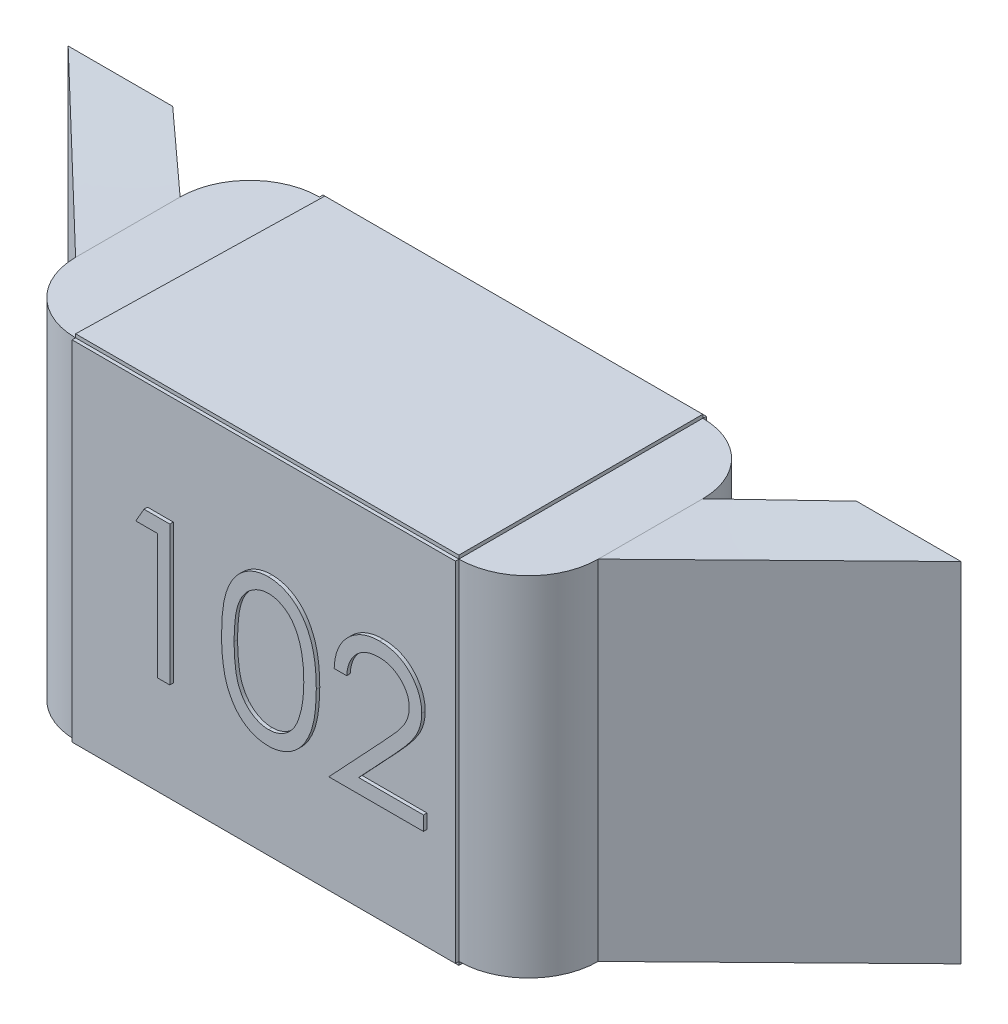
from build123d import *

# Parameters (mm, degrees)
BOSS_EXTRU_1_DEPTH      = 0.35
BOSS_EXTRU_1_DEPTH_BACK = 0.35
ESQUISSE1_W             = 1.5
ESQUISSE1_H             = 1
ESQUISSE2_W             = 1.1
ESQUISSE2_H             = 1
BOSS_EXTRU_2_DEPTH      = 0.01
BOSS_EXTRU_3_DEPTH      = 0.01
CONG_1_R                = 0.2
BOSS_EXTRU_4_DEPTH      = 0.01


with BuildPart() as part:
    # Esquisse1 → Boss.-Extru.1 (new, two sides: drawn at the far end of the back side and taken through both)
    with BuildSketch(Plane.XY.offset(-BOSS_EXTRU_1_DEPTH_BACK)):
        Rectangle(ESQUISSE1_W, ESQUISSE1_H)
    extrude(amount=BOSS_EXTRU_1_DEPTH + BOSS_EXTRU_1_DEPTH_BACK)

    # Esquisse2 → Boss.-Extru.2 (add)
    with BuildSketch(Plane.XY.offset(0.35)):
        Rectangle(ESQUISSE2_W, ESQUISSE2_H)
    boss_extru_2 = extrude(amount=BOSS_EXTRU_2_DEPTH)

    # Esquisse3 → Boss.-Extru.3 (add)
    with BuildSketch(Plane.XZ.offset(0.5)):
        Polygon((-0.55, 0.35), (-0.534610183, -0.35), (0.55, -0.35), (0.55, 0.35), align=None)
    boss_extru_3 = extrude(amount=BOSS_EXTRU_3_DEPTH)

    # Symétrie1: Boss.-Extru.2 across plane
    add(boss_extru_2.mirror(Plane.XY))

    # Symétrie2: Boss.-Extru.3 across plane
    add(boss_extru_3.mirror(Plane.ZX))

    # Congé1
    cong_1_edges = [part.edges().sort_by_distance(p)[0] for p in [
        (-0.75, 0, 0.35),
        (-0.75, 0, -0.35),
        (0.75, 0, -0.35),
        (0.75, 0, 0.35),
    ]]
    fillet(cong_1_edges, radius=CONG_1_R - 0.0001)  # a hair under: the kernel refuses the full size

    # Lissage3: read off the stored shape, not the designer's step
    # Lissage3: loft between two sections, ruled curve by curve
    lissage3_from = [
        Edge.make_bspline([(-0.75, -0.5, -0.15), (-0.75, -0.5, -0.1), (-0.75, -0.5, -0.05), (-0.75, -0.5, 0.05), (-0.75, -0.5, 0.1), (-0.75, -0.5, 0.15)], [0, 0, 0, 0, 0.5, 0.5, 1, 1, 1, 1], 3),
        Edge.make_bspline([(-0.75, 0.5, 0.15), (-0.75, 0.5, 0.1), (-0.75, 0.5, 0.05), (-0.75, 0.5, -0.05), (-0.75, 0.5, -0.1), (-0.75, 0.5, -0.15)], [0, 0, 0, 0, 0.5, 0.5, 1, 1, 1, 1], 3),
        Edge.make_line((-0.75, 0.5, 0.15), (-0.75, -0.5, 0.15)),
        Edge.make_line((-0.75, -0.5, -0.15), (-0.75, 0.5, -0.15)),
    ]
    lissage3_to = [
        Edge.make_bspline([(-0.981354224, -0.495363438, -0.36), (-1.031354224, -0.495363438, -0.36), (-1.081354224, -0.495363438, -0.36), (-1.181354224, -0.495363438, -0.36), (-1.231354224, -0.495363438, -0.36), (-1.281354224, -0.495363438, -0.36)], [0, 0, 0, 0, 0.5, 0.5, 1, 1, 1, 1], 3),
        Edge.make_bspline([(-1.281354224, 0.504636562, -0.36), (-1.231354224, 0.504636562, -0.36), (-1.181354224, 0.504636562, -0.36), (-1.081354224, 0.504636562, -0.36), (-1.031354224, 0.504636562, -0.36), (-0.981354224, 0.504636562, -0.36)], [0, 0, 0, 0, 0.5, 0.5, 1, 1, 1, 1], 3),
        Edge.make_line((-1.281354224, 0.504636562, -0.36), (-1.281354224, -0.495363438, -0.36)),
        Edge.make_line((-0.981354224, -0.495363438, -0.36), (-0.981354224, 0.504636562, -0.36)),
    ]
    lissage3 = Solid(Shell([*[Face.make_surface_from_curves(lissage3_from[k], lissage3_to[k]) for k in range(4)], Face(Wire(lissage3_from)), Face(Wire(lissage3_to))]))
    add(lissage3)

    # Symétrie6: Lissage3 across plane
    add(lissage3.mirror(Plane(origin=(0, 0, 0), x_dir=(0, 0, 1), z_dir=(1, 0, 0))))

    # Esquisse7 → Boss.-Extru.4 (add)
    # profile 1 of 3: a face of its own
    with BuildSketch(Plane.XY.offset(0.36)):
        Polygon((-0.333671765, 0.19228437), (-0.259713432, 0.19228437), (-0.259713432, -0.20771563), (-0.295610868, -0.20771563), (-0.295610868, 0.151258729), (-0.357149329, 0.151258729), align=None)
    # profile 2 of 3: a face of its own
    with BuildSketch(Plane.XY.offset(0.36)):
        with BuildLine():
            add(Edge.make_bspline(
                [(-0.110995483, -0.007875886), (-0.110957996, -0.001464756), (-0.110885175, 0.010988956), (-0.11007507, 0.029135772), (-0.108729316, 0.046159805), (-0.106885045, 0.06206187), (-0.104640705, 0.076846072), (-0.101644649, 0.090472901), (-0.098237471, 0.103005428), (-0.094288621, 0.114484519), (-0.089832873, 0.125064828), (-0.084983243, 0.134941994), (-0.079547267, 0.144101072), (-0.07383562, 0.152688248), (-0.067617097, 0.160562956), (-0.061068664, 0.167836403), (-0.053934735, 0.174340488), (-0.04645782, 0.18026578), (-0.038570224, 0.185460005), (-0.030496777, 0.190035176), (-0.022181907, 0.193943732), (-0.013602915, 0.197016925), (-0.004836908, 0.199555307), (0.004146756, 0.201291187), (0.013362912, 0.202383405), (0.019583648, 0.202487824), (0.022738491, 0.20254078)],
                knots=[0, 0, 0, 0, 1.646270934, 3.197905019, 4.663502075, 6.030701355, 7.308322542, 8.50163776, 9.611534131, 10.641858119, 11.616356847, 12.558055219, 13.465016945, 14.349605745, 15.204443733, 16.039544428, 16.859896111, 17.680448484, 18.487036065, 19.28249412, 20.06191084, 20.843045899, 21.620316918, 22.403196591, 23.190181807, 24, 24, 24, 24], degree=3))
            add(Edge.make_bspline(
                [(0.022738491, 0.20254078), (0.025919689, 0.20248503), (0.03224609, 0.20237416), (0.041599275, 0.201308567), (0.050736382, 0.199540438), (0.059618455, 0.197035184), (0.068318453, 0.193927107), (0.076768328, 0.190031436), (0.085020566, 0.185496708), (0.092944028, 0.180168265), (0.100625698, 0.174227434), (0.107876894, 0.1675117), (0.114698275, 0.160088875), (0.121175453, 0.152038376), (0.127124664, 0.143205795), (0.132790199, 0.133744754), (0.137861289, 0.123489798), (0.142745252, 0.11261203), (0.146960907, 0.100810469), (0.150762764, 0.08815164), (0.153834646, 0.074486018), (0.15639342, 0.059885305), (0.158375694, 0.044295878), (0.159819424, 0.027751156), (0.160582063, 0.010240254), (0.160725686, -0.001732071), (0.160799388, -0.007875886)],
                knots=[0, 0, 0, 0, 0.810914788, 1.612654377, 2.396697861, 3.181598691, 3.963628158, 4.749916497, 5.551656086, 6.361998678, 7.18212741, 8.025565596, 8.878627764, 9.750805457, 10.657531673, 11.591944965, 12.560506719, 13.57287815, 14.630710178, 15.753379473, 16.941251878, 18.199788006, 19.531962791, 20.947069417, 22.433333509, 24, 24, 24, 24], degree=3))
            add(Edge.make_bspline(
                [(0.160799388, -0.007875886), (0.160724922, -0.013992905), (0.160579826, -0.025911665), (0.159827974, -0.043343776), (0.158346987, -0.059800695), (0.156494417, -0.075321891), (0.153928593, -0.089842762), (0.150773717, -0.103413556), (0.147270823, -0.116092878), (0.142946846, -0.127776857), (0.138214194, -0.138628482), (0.133065029, -0.148761871), (0.127548477, -0.15826659), (0.121538335, -0.167066561), (0.11513223, -0.175224122), (0.108193054, -0.182595279), (0.100916416, -0.189357641), (0.09321214, -0.19537497), (0.085165106, -0.200641805), (0.076941211, -0.205351959), (0.068394539, -0.209149982), (0.059718773, -0.212411129), (0.050789817, -0.214902609), (0.041618801, -0.216625336), (0.032252374, -0.217833547), (0.025920766, -0.217925716), (0.022738491, -0.21797204)],
                knots=[0, 0, 0, 0, 1.561518951, 3.042555995, 4.452378317, 5.7783523, 7.031515105, 8.214008947, 9.334062868, 10.386615937, 11.391082383, 12.354592575, 13.286541444, 14.194233754, 15.072674879, 15.931287219, 16.775624067, 17.606195743, 18.42308326, 19.229000347, 20.022332153, 20.807536673, 21.593273796, 22.3848459, 23.188221202, 24, 24, 24, 24], degree=3))
            add(Edge.make_bspline(
                [(0.022738491, -0.21797204), (0.019583735, -0.217918743), (0.013363172, -0.21781365), (0.004145752, -0.216726366), (-0.004800813, -0.214978309), (-0.01352067, -0.212530697), (-0.022058558, -0.209534715), (-0.030298133, -0.205631437), (-0.038331012, -0.201136115), (-0.046135761, -0.196016638), (-0.053565722, -0.190151303), (-0.060662705, -0.183663956), (-0.067248422, -0.176392709), (-0.073378033, -0.168452375), (-0.079203643, -0.159916004), (-0.084562428, -0.150667047), (-0.089519098, -0.140742178), (-0.094049782, -0.130077274), (-0.098066772, -0.11851671), (-0.101615082, -0.105928233), (-0.1044167, -0.092200732), (-0.106814752, -0.077444461), (-0.108748967, -0.061596012), (-0.110069461, -0.04464678), (-0.110885612, -0.026607328), (-0.110958191, -0.014233639), (-0.110995483, -0.007875886)],
                knots=[0, 0, 0, 0, 0.810891512, 1.598919785, 2.382837074, 3.152667961, 3.926044502, 4.706494248, 5.493654104, 6.291793342, 7.103789334, 7.925228297, 8.761435821, 9.622817696, 10.50288917, 11.416980706, 12.369136599, 13.353924996, 14.394355917, 15.514179734, 16.714354668, 17.994756427, 19.357759367, 20.818452758, 22.365282078, 24, 24, 24, 24], degree=3))
        make_face()
        with BuildLine():
            add(Edge.make_bspline(
                [(-0.075098047, -0.00771563), (-0.075084396, -0.013058338), (-0.075057902, -0.023427486), (-0.074365765, -0.038495288), (-0.073422881, -0.05254904), (-0.072206733, -0.065606587), (-0.070400682, -0.077623731), (-0.068377049, -0.088683123), (-0.06591441, -0.098726236), (-0.063000694, -0.107821986), (-0.05968194, -0.116124737), (-0.056058413, -0.12385059), (-0.052165759, -0.131090811), (-0.047809284, -0.137780366), (-0.043064706, -0.143941071), (-0.03803919, -0.149681966), (-0.032545181, -0.154801621), (-0.024944753, -0.160941833), (-0.01491087, -0.167286877), (-0.002268532, -0.172812144), (0.010722148, -0.176284425), (0.019539433, -0.176725997), (0.023940414, -0.176946399)],
                knots=[0, 0, 0, 0, 1.459021318, 2.831673884, 4.118529203, 5.306027144, 6.411944654, 7.436330062, 8.375795394, 9.233974572, 10.042671642, 10.816086306, 11.563610507, 12.285937304, 12.993564865, 13.685989202, 14.367179055, 15.041617293, 16.353048772, 17.594441528, 18.799311195, 20, 20, 20, 20], degree=3))
            add(Edge.make_bspline(
                [(0.023940414, -0.176946399), (0.028369862, -0.176763796), (0.037219614, -0.176398966), (0.05014919, -0.17287911), (0.062701221, -0.167568306), (0.072538014, -0.161288591), (0.080021733, -0.15530821), (0.085383675, -0.150209393), (0.090305052, -0.144500151), (0.094972718, -0.138340232), (0.099253755, -0.131611948), (0.103146685, -0.124347653), (0.106699068, -0.116527176), (0.108722959, -0.111067777), (0.109757722, -0.108276527)],
                knots=[0, 0, 0, 0, 1.353760809, 2.704726607, 4.075137775, 5.516104923, 6.260822281, 7.007110065, 7.778089737, 8.566572457, 9.372053459, 10.217411131, 11.088608312, 12, 12, 12, 12], degree=3))
            add(Edge.make_bspline(
                [(0.109757722, -0.108276527), (0.110963638, -0.104707414), (0.113412165, -0.097460584), (0.116567797, -0.086219024), (0.119052985, -0.074424422), (0.121288798, -0.062147266), (0.122814862, -0.049297015), (0.124043184, -0.035913428), (0.124766691, -0.021986415), (0.124856376, -0.01252413), (0.124901953, -0.00771563)],
                knots=[0, 0, 0, 0, 0.884706709, 1.796334032, 2.740027952, 3.714592787, 4.726048262, 5.777819803, 6.87074269, 8, 8, 8, 8], degree=3))
            add(Edge.make_bspline(
                [(0.124901953, -0.00771563), (0.124839074, -0.002907907), (0.124716069, 0.006497026), (0.124245899, 0.020270532), (0.123031777, 0.033352562), (0.121683306, 0.045799473), (0.119695052, 0.057542365), (0.117551303, 0.068679542), (0.114671164, 0.079073031), (0.111594618, 0.088885555), (0.10807343, 0.098005629), (0.104197346, 0.106475776), (0.100057717, 0.114336888), (0.095561461, 0.121567395), (0.090761954, 0.128199686), (0.08553252, 0.134100783), (0.080080592, 0.139453579), (0.072444342, 0.145563587), (0.06244728, 0.151793495), (0.050007778, 0.157526725), (0.037062561, 0.160819101), (0.028311309, 0.161283294), (0.023940414, 0.161515139)],
                knots=[0, 0, 0, 0, 1.31362396, 2.569729283, 3.763502607, 4.902122613, 5.988968491, 7.01645872, 7.998833611, 8.933434873, 9.825090667, 10.667526885, 11.477055099, 12.250526234, 12.991942729, 13.710640831, 14.402115721, 15.076753259, 16.378508321, 17.609869233, 18.806226677, 20, 20, 20, 20], degree=3))
            add(Edge.make_bspline(
                [(0.023940414, 0.161515139), (0.019516346, 0.161282974), (0.010660152, 0.16081822), (-0.002419615, 0.157538991), (-0.014957255, 0.151823224), (-0.024927881, 0.145542953), (-0.032569456, 0.139561431), (-0.037950335, 0.134374408), (-0.042995612, 0.12870055), (-0.047643349, 0.122483189), (-0.05199641, 0.115801432), (-0.05599424, 0.108602716), (-0.059596221, 0.10085056), (-0.062920168, 0.092551539), (-0.065842772, 0.083456574), (-0.068253511, 0.073425832), (-0.070480603, 0.062401616), (-0.072057205, 0.050319386), (-0.073458777, 0.037258569), (-0.074359502, 0.023169732), (-0.075060218, 0.00807666), (-0.075085185, -0.002346101), (-0.075098047, -0.00771563)],
                knots=[0, 0, 0, 0, 1.207732386, 2.417664972, 3.655092373, 4.956220595, 5.625982001, 6.301752483, 6.994047911, 7.697131622, 8.419323945, 9.170223765, 9.943494443, 10.752040957, 11.610060368, 12.549350801, 13.567764191, 14.679664412, 15.874934091, 17.154273443, 18.533957287, 20, 20, 20, 20], degree=3))
        make_face(mode=Mode.SUBTRACT)
    # profile 3 of 3: a face of its own
    with BuildSketch(Plane.XY.offset(0.36)):
        with BuildLine():
            Line((0.247978876, 0.069207447), (0.21208144, 0.069207447))
            add(Edge.make_bspline(
                [(0.21208144, 0.069207447), (0.2123154, 0.073969834), (0.212774892, 0.083323036), (0.214926696, 0.096960054), (0.218005654, 0.109994888), (0.222358963, 0.122322878), (0.227765395, 0.134053027), (0.234248826, 0.145138743), (0.241928124, 0.155537736), (0.250637465, 0.165153604), (0.260096738, 0.173975041), (0.270303131, 0.181592783), (0.281028277, 0.188029088), (0.292239637, 0.193409802), (0.304063701, 0.197448641), (0.31639317, 0.2004454), (0.329282215, 0.202248411), (0.338063931, 0.202442215), (0.342530158, 0.20254078)],
                knots=[0, 0, 0, 0, 1.10065271, 2.161652631, 3.183658789, 4.190468796, 5.17591951, 6.163126047, 7.15150782, 8.156236427, 9.156009102, 10.134482811, 11.092018607, 12.041330605, 13.001268258, 13.972401359, 14.968799086, 16, 16, 16, 16], degree=3))
            add(Edge.make_bspline(
                [(0.342530158, 0.20254078), (0.346916223, 0.202438099), (0.355534686, 0.202236335), (0.368113201, 0.200503646), (0.380087749, 0.197789865), (0.391434923, 0.193982388), (0.402064187, 0.188864168), (0.412055392, 0.182715878), (0.421527485, 0.17560504), (0.430053975, 0.167233176), (0.437883469, 0.15829576), (0.444638013, 0.148754286), (0.450422374, 0.13889951), (0.455243823, 0.128656287), (0.458793096, 0.11792817), (0.461487749, 0.106871346), (0.463010882, 0.095371368), (0.463244644, 0.087587762), (0.463363491, 0.083630524)],
                knots=[0, 0, 0, 0, 1.111607364, 2.184268762, 3.212621178, 4.221274766, 5.211760367, 6.196651075, 7.1921475, 8.207485113, 9.220403448, 10.201281604, 11.166441695, 12.114753415, 13.065576456, 14.026450734, 14.996634279, 16, 16, 16, 16], degree=3))
            add(Edge.make_bspline(
                [(0.463363491, 0.083630524), (0.463169975, 0.078059343), (0.46278634, 0.067014747), (0.459504697, 0.050784477), (0.454379381, 0.035059515), (0.448208255, 0.022403823), (0.441982832, 0.012205709), (0.436372832, 0.003809286), (0.429805425, -0.005231339), (0.422185025, -0.014885892), (0.413669268, -0.025229995), (0.404181021, -0.0362574), (0.393652623, -0.047854174), (0.38626308, -0.055774814), (0.382434004, -0.059879092)],
                knots=[0, 0, 0, 0, 1.184426356, 2.348067706, 3.509069118, 4.696110526, 5.333549288, 6.050745305, 6.844228056, 7.710549037, 8.667450064, 9.695053472, 10.805634456, 12, 12, 12, 12], degree=3))
            Line((0.382434004, -0.059879092), (0.282353876, -0.166689989))
            Line((0.282353876, -0.166689989), (0.468491696, -0.166689989))
            Line((0.468491696, -0.166689989), (0.468491696, -0.20771563))
            Line((0.468491696, -0.20771563), (0.196696824, -0.20771563))
            Line((0.196696824, -0.20771563), (0.351825029, -0.042170758))
            add(Edge.make_bspline(
                [(0.351825029, -0.042170758), (0.355601931, -0.038228095), (0.362856585, -0.030655045), (0.373117451, -0.019598706), (0.382333336, -0.009341616), (0.390563895, 9.6847e-05), (0.397630581, 0.00885474), (0.403901693, 0.01664842), (0.408926332, 0.023820358), (0.41437952, 0.032133571), (0.419661118, 0.04228355), (0.424199673, 0.0546874), (0.426967085, 0.067456229), (0.427299066, 0.076085033), (0.427466055, 0.080425396)],
                knots=[0, 0, 0, 0, 1.329631726, 2.553950428, 3.673215718, 4.687767853, 5.603093632, 6.413772471, 7.123043292, 7.734684054, 8.834405432, 9.900288307, 10.943827018, 12, 12, 12, 12], degree=3))
            add(Edge.make_bspline(
                [(0.427466055, 0.080425396), (0.427393399, 0.083154698), (0.427250207, 0.08853363), (0.42598647, 0.096420002), (0.424076698, 0.104027409), (0.421340097, 0.111379252), (0.417727899, 0.118401612), (0.413330941, 0.125103038), (0.408257791, 0.131581777), (0.402389074, 0.13765644), (0.395942043, 0.143220006), (0.389131272, 0.148148473), (0.381925546, 0.152267228), (0.374355246, 0.155643628), (0.366441478, 0.158292243), (0.358168936, 0.160127509), (0.349560477, 0.161279793), (0.343682363, 0.161435699), (0.340687209, 0.161515139)],
                knots=[0, 0, 0, 0, 0.991446411, 1.95395049, 2.89581595, 3.838931463, 4.798493298, 5.75982156, 6.748411868, 7.785213223, 8.824556874, 9.840280684, 10.836137867, 11.835679398, 12.848801643, 13.863922112, 14.911575587, 16, 16, 16, 16], degree=3))
            add(Edge.make_bspline(
                [(0.340687209, 0.161515139), (0.337559114, 0.161433421), (0.331416051, 0.161272941), (0.322396733, 0.16015035), (0.313792644, 0.158213683), (0.305582141, 0.15556492), (0.297751331, 0.152198229), (0.290338298, 0.148004887), (0.283359682, 0.143001059), (0.276802365, 0.137327852), (0.270760767, 0.131011555), (0.265452553, 0.123970416), (0.26081438, 0.116332998), (0.25676761, 0.108119906), (0.253481246, 0.099256617), (0.250970029, 0.089774594), (0.24898296, 0.079715007), (0.24831913, 0.07276814), (0.247978876, 0.069207447)],
                knots=[0, 0, 0, 0, 1.031018746, 2.02475058, 2.990194455, 3.934040569, 4.864654155, 5.795059489, 6.735614925, 7.690564532, 8.649604399, 9.611025574, 10.590972636, 11.591080095, 12.624614302, 13.701020113, 14.821632451, 16, 16, 16, 16], degree=3))
        make_face()
    extrude(amount=BOSS_EXTRU_4_DEPTH)


solid = part.part
